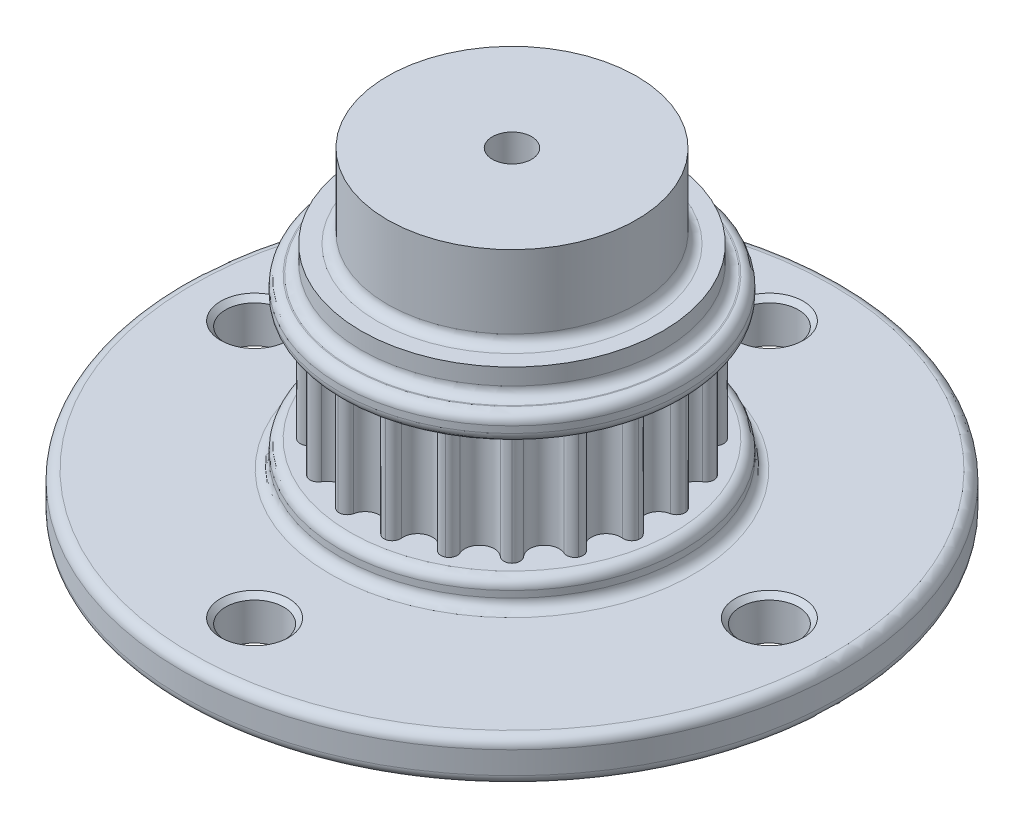
from build123d import *

# Parameters (mm, degrees)
BOSS_EXTRUDE1_DEPTH     = 3.556
CIRPATTERN1_COUNT       = 20
SKETCH9_R               = 19.84375
SKETCH9_R_2             = 1.4999999999999996
BOSS_EXTRUDE2_DEPTH     = 2.54
CUT_EXTRUDE1_DEPTH      = 30.081395842465593
CUT_EXTRUDE1_DEPTH_BACK = 30.081395842465593
SKETCH3_R               = 1.7462499999999996
SKETCH3_R_2             = 1.746249999999999
SKETCH3_R_3             = 1.7462500000000012
SKETCH3_R_4             = 1.7462499999999985
CIRPATTERN2_COUNT       = 4
FILLET1_R               = 0.5953125
CUT_EXTRUDE2_START      = -6
SKETCH11_R              = 1.5
CUT_EXTRUDE2_DEPTH      = 6


with BuildPart() as part:
    # Sketch1 → Boss-Extrude1 (new, symmetric)
    with BuildSketch(Plane(origin=(0, 0, 0), x_dir=(1, 0, 0), z_dir=(0, 1, 0))):
        with BuildLine():
            ThreePointArc((0.8720606070123648, 8.659786465382457), (0.5629673031092283, 8.148255135369217), (0, 7.947579307894175))
            ThreePointArc((0, 7.947579307894175), (-1.2432753173952258, -7.8497314183622535), (2.4559370702819923, 7.558597089545281))
            ThreePointArc((2.4559370702819887, 7.558597089545281), (1.982535589248892, 7.923417606866525), (1.8466422625579257, 8.505427895318311))
            ThreePointArc((1.846642262557925, 8.505427895318311), (1.749626992044169, 8.862101959434877), (1.4341191216417435, 9.054671776489402))
            ThreePointArc((1.4341191216417435, 9.054671776489402), (1.0745459594794837, 8.96902429095141), (0.8720606070123653, 8.659786465382457))
        make_face()
    boss_extrude1 = extrude(amount=BOSS_EXTRUDE1_DEPTH, both=True)

    # CirPattern1: Boss-Extrude1 ×20 about axis
    cirpattern1_axis = Axis((0, 3.3, 0), (0, -1, 0))
    for i in range(1, CIRPATTERN1_COUNT):
        add(boss_extrude1.rotate(cirpattern1_axis, i * 360 / CIRPATTERN1_COUNT))

    # Sketch2 → Revolve3 (revolve)
    with BuildSketch(Plane(origin=(0, 0, 0), x_dir=(0, 0, -1), z_dir=(1, 0, 0))):
        Polygon((10.342329407894177, 5.087499985000001), (0, 5.087499985), (2e-16, 3.4999999849999996), (10.342329407894177, 3.499999985000001), align=None)
    revolve3 = revolve(axis=Axis((0, 3.3, 0), (0, -1, 0)))

    # Mirror1: Revolve3 across plane
    add(revolve3.mirror(Plane.ZX))

    # Sketch9 → Boss-Extrude2 (add)
    with BuildSketch(Plane.XZ.offset(5.087499985000001)):
        Circle(SKETCH9_R)
        Circle(SKETCH9_R_2, mode=Mode.SUBTRACT)
    extrude(amount=BOSS_EXTRUDE2_DEPTH)

    # Sketch3 → Cut-Extrude1 (cut, two sides: drawn at the far end of the back side and taken through both)
    with BuildSketch(Plane(origin=(0, 0, 0), x_dir=(1, 0, 0), z_dir=(0, 1, 0)).offset(-CUT_EXTRUDE1_DEPTH_BACK)):
        with Locations((-15.5, 0)):
            Circle(SKETCH3_R)
        with Locations((0, 15.500000000000002)):
            Circle(SKETCH3_R_2)
        with Locations((15.500000000000002, 0)):
            Circle(SKETCH3_R_3)
        with Locations((3.47e-15, -15.500000000000002)):
            Circle(SKETCH3_R_4)
    extrude(amount=CUT_EXTRUDE1_DEPTH + CUT_EXTRUDE1_DEPTH_BACK, mode=Mode.SUBTRACT)

    # Sketch6 → Cut-Revolve2 (revolve, cut)
    with BuildSketch(Plane.XY):
        Polygon((-11.8678, -3.499999985), (-15.5, -7.132199984999997), (-15.5, -3.499999985), align=None)
    cut_revolve2 = revolve(axis=Axis((-15.5, -7.627499985000001, 0), (0, 1, 0)), mode=Mode.SUBTRACT)

    # CirPattern2: Cut-Revolve2 ×4 about axis
    cirpattern2_axis = Axis((0, 3.3, 0), (0, -1, 0))
    for i in range(1, CIRPATTERN2_COUNT):
        add(cut_revolve2.rotate(cirpattern2_axis, i * 360 / CIRPATTERN2_COUNT), mode=Mode.SUBTRACT)

    # Sketch10 → Revolve4 (revolve)
    with BuildSketch(Plane(origin=(0, 0, 0), x_dir=(0, 0, -1), z_dir=(1, 0, 0))):
        Polygon((1.1821750652977259, 6.674999985000001), (1.1821750652977259, 11.674999985), (7.499999999999998, 11.674999985), (7.499999999999999, 6.674999985000001), (9.087499999999999, 6.674999985000001), (9.087500000000002, 5.087499985000001), (1.182175065297726, 5.087499985000001), align=None)
    revolve(axis=Axis((0, 0, 0), (0, 1, 0)))

    # Fillet1
    fillet1_edges = [part.edges().sort_by_distance(p)[0] for p in [
        (1.27e-15, 5.087499985000001, 10.342329407894177),
        (1.27e-15, 3.499999985000001, 10.342329407894177),
        (-19.84375, -7.627499985000001, 2.43e-15),
        (-19.84375, -5.087499985000001, 2.43e-15),
        (-9.2e-16, 6.674999985000001, 7.499999999999999),
        (-1.11e-15, 5.087499985000001, 9.087500000000002),
        (1.27e-15, -3.499999985000001, 10.342329407894177),
        (1.27e-15, -5.087499985000001, 10.342329407894177),
    ]]
    fillet(fillet1_edges, radius=FILLET1_R)

    # Sketch11 → Cut-Extrude2 (cut)
    with BuildSketch(Plane.XZ.offset(5.087499985000001).offset(CUT_EXTRUDE2_START)):
        Circle(SKETCH11_R)
    extrude(amount=CUT_EXTRUDE2_DEPTH, mode=Mode.SUBTRACT)


solid = part.part
